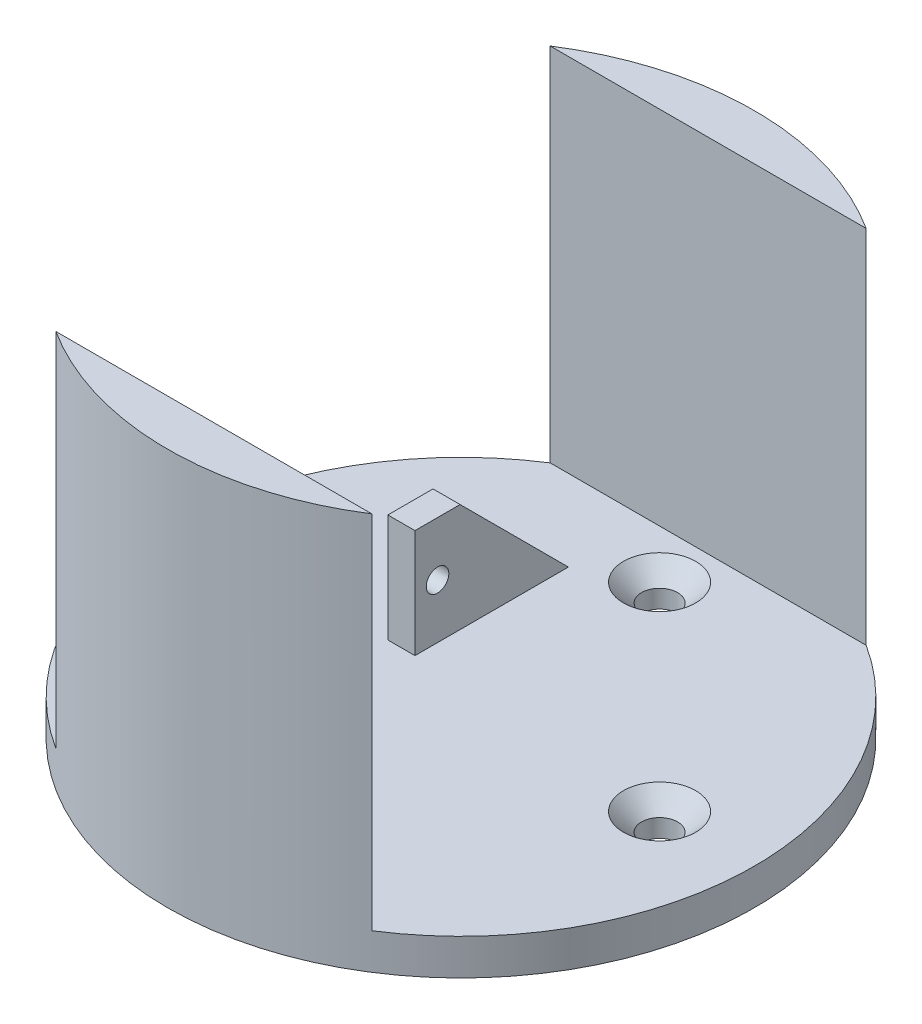
from build123d import *
from build123d.topology import SkipClean

# Parameters (mm, degrees)
SKETCH1_R           = 32.5
SKETCH1_R_2         = 2
BOSS_EXTRUDE1_DEPTH = 4
BOSS_EXTRUDE2_DEPTH = 40
CHAMFER1_SIZE       = 2
SKETCH3_W           = 3
SKETCH3_H           = 5
BOSS_EXTRUDE3_DEPTH = 12
SKETCH4_R           = 1.25
CUT_EXTRUDE1_DEPTH  = 3
CUT_EXTRUDE2_DEPTH  = 3
CHAMFER3_SIZE       = 12


with BuildPart() as part:
    # Sketch1 → Boss-Extrude1 (new body)
    with BuildSketch(Plane(origin=(0, 0, 0), x_dir=(1, 0, 0), z_dir=(0, 1, 0))):
        with Locations(Location((0, 0, 0), (0, 0, 270))):
            Circle(SKETCH1_R)
        with Locations(Location((-22, 0, 0), (0, 0, 270))):
            Circle(SKETCH1_R_2, mode=Mode.SUBTRACT)
        with Locations(Location((0, 22, 0), (0, 0, 270))):
            Circle(SKETCH1_R_2, mode=Mode.SUBTRACT)
        with Locations(Location((22, 0, 0), (0, 0, 270))):
            Circle(SKETCH1_R_2, mode=Mode.SUBTRACT)
        with Locations(Location((0, -22, 0), (0, 0, 270))):
            Circle(SKETCH1_R_2, mode=Mode.SUBTRACT)
    extrude(amount=BOSS_EXTRUDE1_DEPTH)

    # Sketch2 → Boss-Extrude2 (add)
    with SkipClean():  # the faces are left unmerged after this step: merging them gives an invalid solid
        with BuildSketch(Plane(origin=(0, 4, 0), x_dir=(1, 0, 0), z_dir=(0, 1, 0))):
            with BuildLine():
                Line((17.5, 27.386127875), (-17.5, 27.386127875))
                ThreePointArc((-17.5, 27.386127875), (0, 32.5), (17.5, 27.386127875))
            make_face()
            with BuildLine():
                Line((17.5, -27.386127875), (-17.5, -27.386127875))
                ThreePointArc((-17.5, -27.386127875), (0, -32.5), (17.5, -27.386127875))
            make_face()
        extrude(amount=BOSS_EXTRUDE2_DEPTH)

    # Chamfer1
    chamfer1_edges = [part.edges().sort_by_distance(p)[0] for p in [
        (22, 4, -2),
        (0, 4, 20),
        (-22, 4, -2),
        (0, 4, -24),
    ]]
    chamfer(chamfer1_edges, length=CHAMFER1_SIZE)

    # Sketch3 → Boss-Extrude3 (add)
    with SkipClean():  # the faces are left unmerged after this step: merging them gives an invalid solid
        with BuildSketch(Plane(origin=(0, 4, 0), x_dir=(1, 0, 0), z_dir=(0, 1, 0))):
            with Locations((-8, 3.9)):
                Rectangle(SKETCH3_W, SKETCH3_H)
            with Locations((-8, -23.9)):
                Rectangle(SKETCH3_W, SKETCH3_H)
        extrude(amount=BOSS_EXTRUDE3_DEPTH)

    # Sketch4 → Cut-Extrude1 (cut)
    with SkipClean():  # the faces are left unmerged after this step: merging them gives an invalid solid
        with BuildSketch(Plane.ZY.offset(9.5)):
            with Locations((-3.9, 10)):
                Circle(SKETCH4_R)
            with Locations((23.9, 10)):
                Circle(SKETCH4_R)
        extrude(amount=-CUT_EXTRUDE1_DEPTH, mode=Mode.SUBTRACT)

    # Sketch5 → Cut-Extrude2 (cut)
    with SkipClean():  # the faces are left unmerged after this step: merging them gives an invalid solid
        with BuildSketch(Plane(origin=(0, 4, 0), x_dir=(1, 0, 0), z_dir=(0, 1, 0))):
            with BuildLine():
                Line((-30.95, 1.9), (-30.95, -3.1))
                ThreePointArc((-30.95, -3.1), (-28.95, -5.1), (-26.95, -3.1))
                Line((-26.95, -3.1), (-26.95, 1.9))
                ThreePointArc((-26.95, 1.9), (-28.95, 3.9), (-30.95, 1.9))
            make_face()
        extrude(amount=-CUT_EXTRUDE2_DEPTH, mode=Mode.SUBTRACT)

    # Chamfer3
    # the kernel refuses this chamfer: 12 mm, written as the material it adds along each edge
    with BuildSketch(Plane(origin=(-9.5, 4, -6.4), x_dir=(0, -0.02749587661058638, -0.9996219169112968), z_dir=(1, 0, 0))) as chamfer3_piece_1_section:
        Polygon((CHAMFER3_SIZE * 0.999621916911, CHAMFER3_SIZE * 0.0274958766106), (-CHAMFER3_SIZE * 0.0274958766106, CHAMFER3_SIZE * 0.999621916911), (0, 0), align=None)
    chamfer3_piece_1 = extrude(amount=3, mode=Mode.PRIVATE)
    chamfer3_piece_1 = split(chamfer3_piece_1, bisect_by=Plane(origin=(-8, 16, -10.364849852), z_dir=(0, -1, 0)), keep=Keep.TOP, mode=Mode.PRIVATE)
    add(chamfer3_piece_1)
    with BuildSketch(Plane(origin=(-6.5, 4, 26.4), x_dir=(-1.1837901526131805e-15, -0.027495876610586386, 0.9996219169112968), z_dir=(-1, 0, 0))) as chamfer3_piece_2_section:
        Polygon((CHAMFER3_SIZE * 0.999621916911, CHAMFER3_SIZE * 0.0274958766106), (-CHAMFER3_SIZE * 0.0274958766106, CHAMFER3_SIZE * 0.999621916911), (0, 0), align=None)
    chamfer3_piece_2 = extrude(amount=3, mode=Mode.PRIVATE)
    chamfer3_piece_2 = chamfer3_piece_2 & Plane(origin=(0, 8.886128488, 0), x_dir=(0, 0, 1), z_dir=(0, -1, 0)) * Cylinder(32.5, 54, mode=Mode.PRIVATE)
    chamfer3_piece_2 = split(chamfer3_piece_2, bisect_by=Plane(origin=(-7.974151993, 16, 28.556689734), z_dir=(0, -1, 0)), keep=Keep.TOP, mode=Mode.PRIVATE)
    add(chamfer3_piece_2)


solid = part.part
